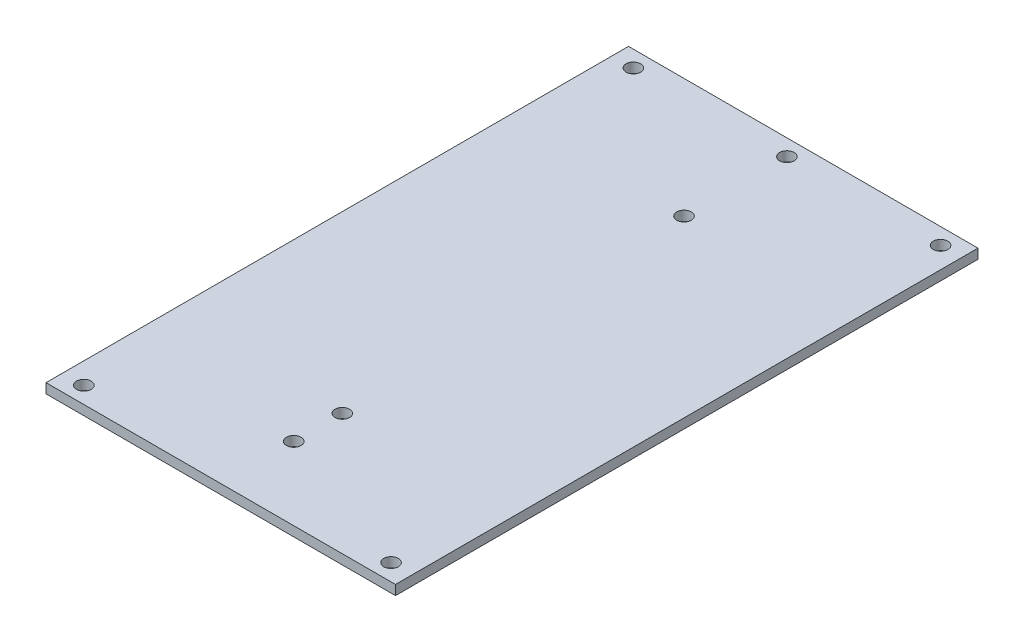
from build123d import *

# Parameters (mm, degrees)
SKETCH1_W           = 228.6
SKETCH1_H           = 381
SKETCH1_R           = 4.7625
BOSS_EXTRUDE1_DEPTH = 6.35


with BuildPart() as part:
    # Sketch1 → Boss-Extrude1 (new body)
    with BuildSketch(Plane(origin=(0, 0, 0), x_dir=(1, 0, 0), z_dir=(0, 1, 0))):
        with Locations((0, 33.528)):
            Rectangle(SKETCH1_W, SKETCH1_H)
        with Locations((-100.457, -146.05)):
            Circle(SKETCH1_R, mode=Mode.SUBTRACT)
        with Locations((0, -77.47)):
            Circle(SKETCH1_R, mode=Mode.SUBTRACT)
        with Locations((0, -109.22)):
            Circle(SKETCH1_R, mode=Mode.SUBTRACT)
        with BuildLine():
            ThreePointArc((105.2195, -146.05), (100.457, -150.8125), (95.6945, -146.05))
            ThreePointArc((95.6945, -146.05), (100.457, -141.2875), (105.2195, -146.05))
        make_face(mode=Mode.SUBTRACT)
        with Locations((-100.457, 213.36)):
            Circle(SKETCH1_R, mode=Mode.SUBTRACT)
        with Locations((0, 146.05)):
            Circle(SKETCH1_R, mode=Mode.SUBTRACT)
        with BuildLine():
            ThreePointArc((4.7625, 213.36), (0, 208.5975), (-4.7625, 213.36))
            ThreePointArc((-4.7625, 213.36), (0, 218.1225), (4.7625, 213.36))
        make_face(mode=Mode.SUBTRACT)
        with BuildLine():
            ThreePointArc((105.2195, 213.36), (100.457, 208.5975), (95.6945, 213.36))
            ThreePointArc((95.6945, 213.36), (100.457, 218.1225), (105.2195, 213.36))
        make_face(mode=Mode.SUBTRACT)
    extrude(amount=BOSS_EXTRUDE1_DEPTH)


solid = part.part
